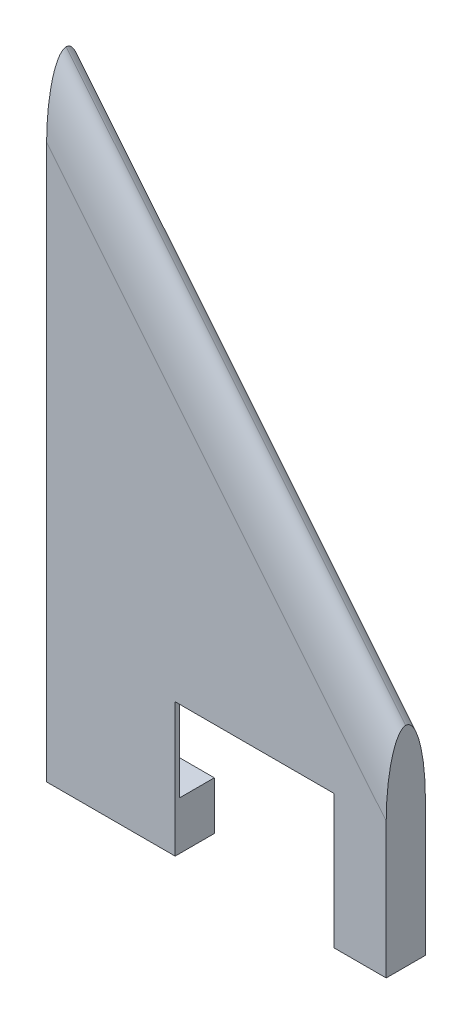
from build123d import *

# Parameters (mm, degrees)
CORE_DEPTH                = 4.7625
CORE_DEPTH_BACK           = 4.7625
LEADINGEDGE_START         = -118.279773997
LEADINGEDGE_DEPTH         = 144.703179824
CTRLSURFCUTOUT_DEPTH      = 174.386689122
CTRLSURFCUTOUT_DEPTH_BACK = 174.386689122
SERVOPKT_DEPTH            = 8.516499985
WIREPKT_START             = -8.516499985
WIREPKT_DEPTH             = 8.516499985


# Read off the part's stored shape, not the designer's step: LeadingEdge, WirePkt
with BuildPart() as part:
    # Sketch2 → Core (new, two sides: drawn at the far end of the back side and taken through both)
    with BuildSketch(Plane.XY.offset(-CORE_DEPTH_BACK)):
        Polygon((0, 0), (82.55, 0), (82.55, 50.8), (0, 152.4), align=None)
    extrude(amount=CORE_DEPTH + CORE_DEPTH_BACK)

    # LeadingEdge outline → LeadingEdge (cut)
    with BuildSketch(Plane(origin=(0, 0, 0), x_dir=(0.7761140001162661, 0.630592625094465, 0), z_dir=(0.6305926250944651, -0.776114000116266, 0)).offset(LEADINGEDGE_START)):
        with BuildLine():
            Line((96.102316064, 4.7625), (84.894223283, 4.7625))
            add(Edge.make_bspline(
                [(84.894223283, 4.7625), (91.459772026, 4.7625), (96.102316064, 2.789807909), (96.102316064, 0)],
                knots=[0, 0, 0, 0, 1, 1, 1, 1], degree=3, weights=[1, 0.804737854, 0.804737854, 1]))
            Line((96.102316064, 0), (96.102316064, 4.7625))
        make_face()
    leadingedge = extrude(amount=LEADINGEDGE_DEPTH, mode=Mode.SUBTRACT)

    # LeadingEdgeMirror: LeadingEdge across plane
    add(leadingedge.mirror(Plane.XY), mode=Mode.SUBTRACT)

    # Sketch4 → CtrlSurfCutout (cut, two sides: drawn at the far end of the back side and taken through both)
    with BuildSketch(Plane.XY.offset(-CTRLSURFCUTOUT_DEPTH_BACK)):
        Polygon((31.242, 0), (69.85, 0), (69.85, 31.75), (69.85, 32.512), (69.596, 32.512), (31.496, 32.512), (31.242, 32.512), align=None)
    extrude(amount=CTRLSURFCUTOUT_DEPTH + CTRLSURFCUTOUT_DEPTH_BACK, mode=Mode.SUBTRACT)

    # Sketch7 → ServoPkt (cut)
    with BuildSketch(Plane(origin=(0, 0, -4.7625), x_dir=(-1, 0, 0), z_dir=(0, 0, -1))):
        with BuildLine():
            Line((-31.242, 32.241499906), (-17.562999926, 32.241499906))
            ThreePointArc((-17.562999926, 32.241499906), (-15.317935896, 31.311563936), (-14.387999926, 29.066499906))
            Line((-14.387999926, 29.066499906), (-14.387999926, 11.733500028))
            ThreePointArc((-14.387999926, 11.733500028), (-17.562999926, 8.558500028), (-20.737999926, 11.733500028))
            Line((-20.737999926, 11.733500028), (-31.242, 11.733500028))
            Line((-31.242, 11.733500028), (-31.242, 32.241499906))
        make_face()
    extrude(amount=-SERVOPKT_DEPTH, mode=Mode.SUBTRACT)

    # WirePkt outline → WirePkt (cut)
    with BuildSketch(Plane(origin=(0, 0, -4.7625), x_dir=(-1, 0, 0), z_dir=(0, 0, -1)).offset(WIREPKT_START)):
        with BuildLine():
            Line((-14.387999926, 29.066499906), (-14.387999926, 26.261862953))
            ThreePointArc((-14.387999926, 26.261862953), (-12.181797279, 27.210752433), (-10.283063956, 28.681307815))
            Line((-10.283063956, 28.681307815), (0, 38.964371771))
            Line((0, 38.964371771), (0, 47.944627893))
            Line((0, 47.944627893), (-14.773192017, 33.171435876))
            ThreePointArc((-14.773192017, 33.171435876), (-15.803236149, 32.48318239), (-17.018256047, 32.241499906))
            Line((-17.018256047, 32.241499906), (-17.562999926, 32.241499906))
            ThreePointArc((-17.562999926, 32.241499906), (-15.317935896, 31.311563936), (-14.387999926, 29.066499906))
        make_face()
    extrude(amount=WIREPKT_DEPTH, mode=Mode.SUBTRACT)


solid = part.part
